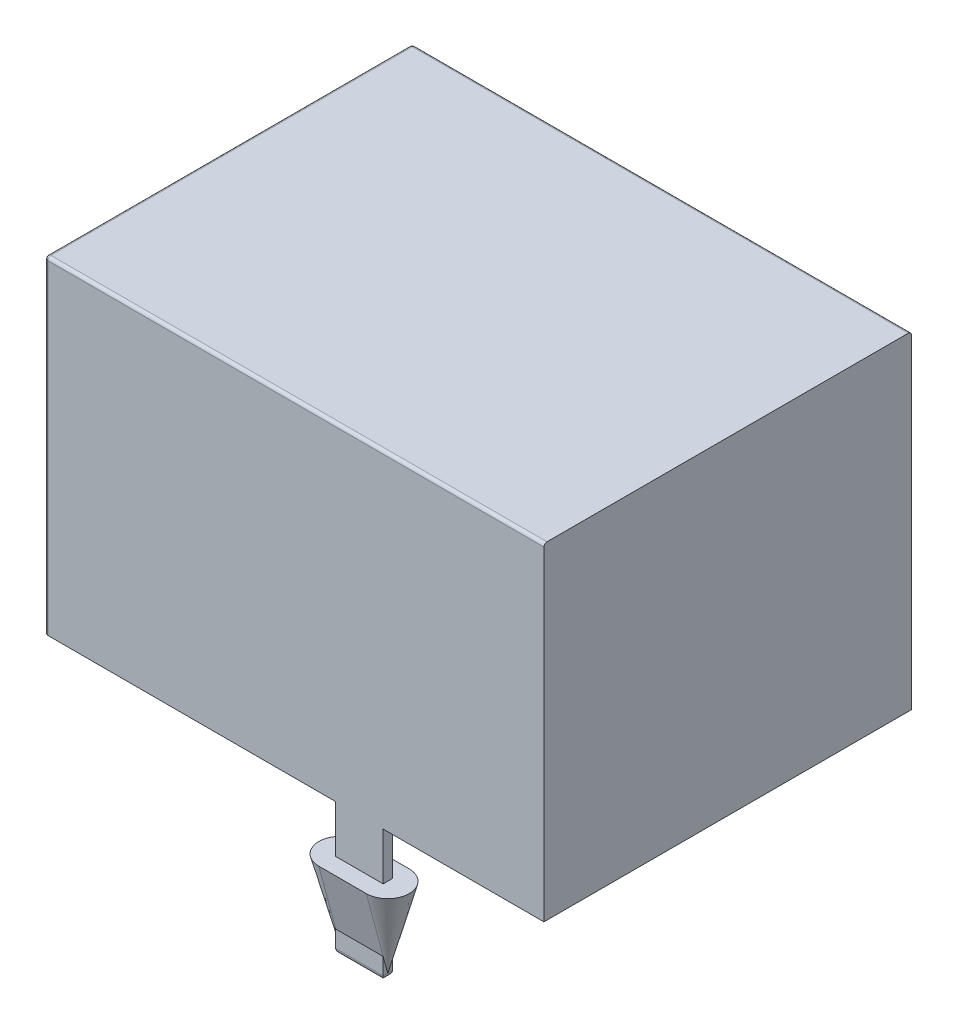
from build123d import *

# Parameters (mm, degrees)
ESQUISSE1_W                  = 16.3
ESQUISSE1_H                  = 12
BOSS_EXTRU_1_DEPTH           = 10.7
ENL_V_MAT_EXTRU_1_DEPTH      = 9
ESQUISSE4_W                  = 5.6
ESQUISSE4_H                  = 3.1
BOSS_EXTRU_2_DEPTH           = 8.8
CHANFREIN1_SIZE              = 0.2
CONG_1_R                     = 0.1
ESQUISSE5_W                  = 1.55
ESQUISSE5_H                  = 0.3
BOSS_EXTRU_3_DEPTH           = 4.3
BOSS_EXTRU_4_DEPTH           = 2.6
BOSS_EXTRU_4_DRAFT           = -15
BOSS_EXTRU_4_PROFILE_2_DEPTH = 2.6
BOSS_EXTRU_4_PROFILE_2_DRAFT = -15
CONG_3_R                     = 0.15


with BuildPart() as part:
    # Esquisse1 → Boss.-Extru.1 (new body)
    with BuildSketch(Plane(origin=(0, 0, 0), x_dir=(1, 0, 0), z_dir=(0, 1, 0))):
        with Locations((-8.15, 6)):
            Rectangle(ESQUISSE1_W, ESQUISSE1_H)
    extrude(amount=BOSS_EXTRU_1_DEPTH)

    # Esquisse2 → Enlèv. mat.-Extru.1 (cut)
    with BuildSketch(Plane.ZY.offset(16.3)):
        Polygon((-8.6, 9.25), (-10.2, 7.65), (-10.2, 1.65), (-1.8, 1.65), (-1.8, 7.65), (-3.4, 9.25), align=None)
    extrude(amount=-ENL_V_MAT_EXTRU_1_DEPTH, mode=Mode.SUBTRACT)

    # Esquisse4 → Boss.-Extru.2 (add)
    with BuildSketch(Plane.ZY.offset(7.3)):
        with Locations((-6, 5.4)):
            Rectangle(ESQUISSE4_W, ESQUISSE4_H)
    extrude(amount=BOSS_EXTRU_2_DEPTH)

    # Chanfrein1
    chanfrein1_edges = [part.edges().sort_by_distance(p)[0] for p in [
        (-16.3, 4.65, -10.2),
        (-16.3, 1.65, -6),
        (-16.3, 4.65, -1.8),
        (-16.3, 8.45, -2.6),
        (-16.3, 9.25, -6),
        (-16.3, 8.45, -9.4),
        (-11.7, 6.95, -8.8),
        (-11.7, 3.85, -8.8),
        (-11.7, 3.85, -3.2),
        (-11.7, 6.95, -3.2),
        (-16.1, 5.4, -8.8),
        (-16.1, 3.85, -6),
        (-16.1, 5.4, -3.2),
        (-16.1, 6.95, -6),
    ]]
    chamfer(chanfrein1_edges, length=CHANFREIN1_SIZE)

    # Congé1
    cong_1_edges = [part.edges().sort_by_distance(p)[0] for p in [
        (-16.3, 10.7, -6),
        (-8.15, 10.7, 0),
        (-16.3, 0, -6),
        (-8.15, 10.7, -12),
        (-16.3, 5.35, 0),
        (-16.3, 5.35, -12),
    ]]
    fillet(cong_1_edges, radius=CONG_1_R)

    # Esquisse5 → Boss.-Extru.3 (add)
    with BuildSketch(Plane.XZ):
        with Locations((-6.025, -0.15)):
            Rectangle(ESQUISSE5_W, ESQUISSE5_H)
        with Locations((-6.025, -11.85)):
            Rectangle(ESQUISSE5_W, ESQUISSE5_H)
    extrude(amount=BOSS_EXTRU_3_DEPTH)


with BuildPart() as boss_extru_4_tool:
    # Esquisse6 → Boss.-Extru.4 (with draft: the straight prism first)
    with BuildSketch(Plane(origin=(0, -1.55, 0), x_dir=(1, 0, 0), z_dir=(0, 1, 0))):
        with BuildLine():
            ThreePointArc((-6.8, 0.85), (-7.5, 0.15), (-6.8, -0.55))
            Line((-6.8, -0.55), (-5.25, -0.55))
            ThreePointArc((-5.25, -0.55), (-4.55, 0.15), (-5.25, 0.85))
            Line((-5.25, 0.85), (-6.8, 0.85))
        make_face()
    extrude(amount=-BOSS_EXTRU_4_DEPTH)
    # Boss.-Extru.4: the draft: its side faces are tilted about the plane it starts from
    boss_extru_4_sides = [boss_extru_4_tool.faces().sort_by_distance(p)[0] for p in [
        (-6.025, -2.85, 0.55),
        (-4.55, -2.85, -0.15),
        (-6.025, -2.85, -0.85),
        (-7.5, -2.85, -0.15),
    ]]
    draft(boss_extru_4_sides, Plane(origin=(0, -1.55, 0), x_dir=(1, 0, 0), z_dir=(0, 1, 0)), BOSS_EXTRU_4_DRAFT)


with BuildPart() as part_1:
    add(part.part)

    # Boss.-Extru.4: add boss_extru_4_tool
    add(boss_extru_4_tool.part)


with BuildPart() as boss_extru_4_profile_2_tool:
    # Esquisse6 → Boss.-Extru.4 profile 2 (with draft: the straight prism first)
    with BuildSketch(Plane(origin=(0, -1.55, 0), x_dir=(1, 0, 0), z_dir=(0, 1, 0))):
        with BuildLine():
            ThreePointArc((-6.8, 12.55), (-7.5, 11.85), (-6.8, 11.15))
            Line((-6.8, 11.15), (-5.25, 11.15))
            ThreePointArc((-5.25, 11.15), (-4.55, 11.85), (-5.25, 12.55))
            Line((-5.25, 12.55), (-6.8, 12.55))
        make_face()
    extrude(amount=-BOSS_EXTRU_4_PROFILE_2_DEPTH)
    # Boss.-Extru.4 profile 2: the draft: its side faces are tilted about the plane it starts from
    boss_extru_4_profile_2_sides = [boss_extru_4_profile_2_tool.faces().sort_by_distance(p)[0] for p in [
        (-7.5, -2.85, -11.85),
        (-6.025, -2.85, -11.15),
        (-4.55, -2.85, -11.85),
        (-6.025, -2.85, -12.55),
    ]]
    draft(boss_extru_4_profile_2_sides, Plane(origin=(0, -1.55, 0), x_dir=(1, 0, 0), z_dir=(0, 1, 0)), BOSS_EXTRU_4_PROFILE_2_DRAFT)


with BuildPart() as part_2:
    add(part_1.part)

    # Boss.-Extru.4 profile 2: add boss_extru_4_profile_2_tool
    add(boss_extru_4_profile_2_tool.part)

    # Congé3
    cong_3_edges = [part_2.edges().sort_by_distance(p)[0] for p in [
        (-6.8, -4.3, -0.15),
        (-6.025, -4.3, -0.3),
        (-5.25, -4.3, -0.15),
        (-6.025, -4.3, 0),
        (-6.025, -4.3, -12),
        (-5.25, -4.3, -11.85),
        (-6.025, -4.3, -11.7),
        (-6.8, -4.3, -11.85),
    ]]
    fillet(cong_3_edges, radius=CONG_3_R - 0.0001)  # a hair under: the kernel refuses the full size


solid = part_2.part
